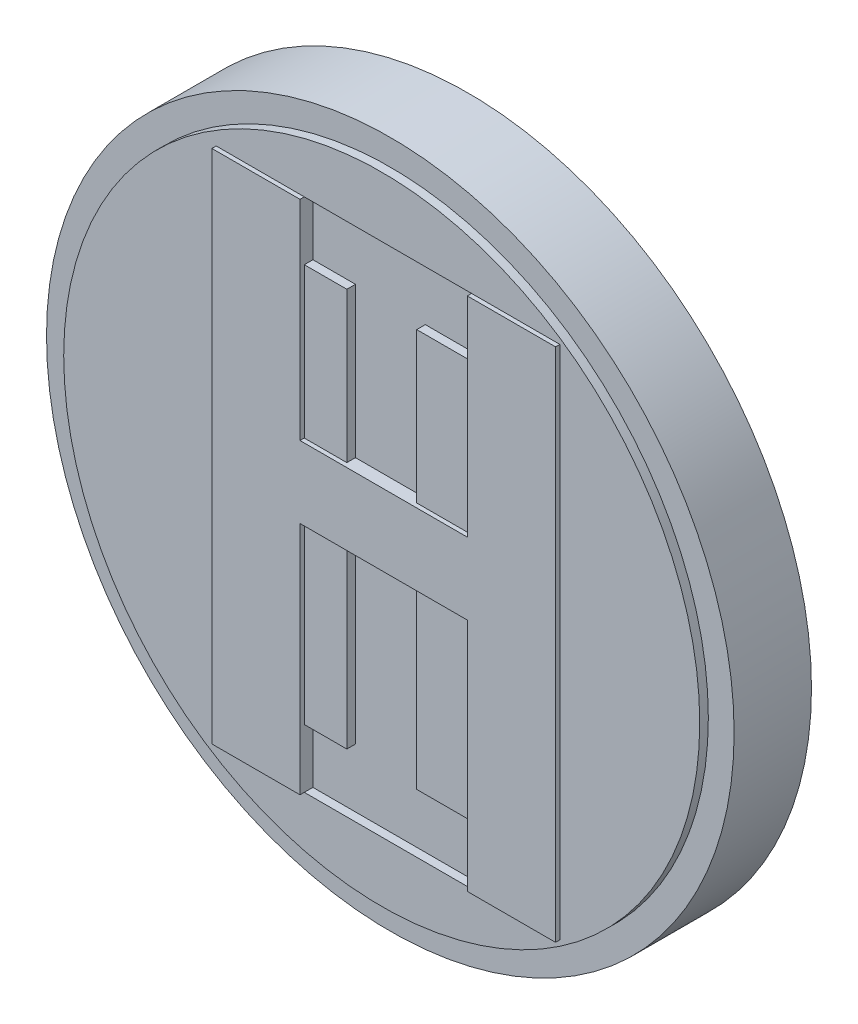
from build123d import *

# Parameters (mm, degrees)
SKETCH2_R                = 40
BOSS_EXTRUDE1_DEPTH      = 10
CUT_EXTRUDE1_START       = -1
CUT_EXTRUDE1_OUTLINE_R   = 40
CUT_EXTRUDE1_OUTLINE_R_2 = 37
CUT_EXTRUDE1_DEPTH       = 1
CUT_EXTRUDE1_2_DEPTH     = 0.5


# Read off the part's stored shape, not the designer's step: Cut-Extrude1
with BuildPart() as part:
    # Sketch2 → Boss-Extrude1 (new body)
    with BuildSketch(Plane.XY):
        Circle(SKETCH2_R)
    extrude(amount=-BOSS_EXTRUDE1_DEPTH)

    # Cut-Extrude1 outline → Cut-Extrude1 (cut)
    # profile 1 of 3: a face of its own
    with BuildSketch(Plane.XY.offset(CUT_EXTRUDE1_START)):
        Circle(CUT_EXTRUDE1_OUTLINE_R)
        Circle(CUT_EXTRUDE1_OUTLINE_R_2, mode=Mode.SUBTRACT)
    # profile 2 of 3: a face of its own
    with BuildSketch(Plane.XY.offset(CUT_EXTRUDE1_START)):
        Polygon((-9.007120253, -30), (10.454905063, -30), (10.454905063, -23.164556962), (4.070411392, -23.164556962), (4.070411392, -2.658227848), (-4.058544304, -2.658227848), (-4.058544304, -23.164556962), (-9.007120253, -23.164556962), align=None)
    # profile 3 of 3: a face of its own
    with BuildSketch(Plane.XY.offset(CUT_EXTRUDE1_START)):
        Polygon((-4.058544304, 5.696202532), (4.070411392, 5.696202532), (4.070411392, 23.164556962), (10.454905063, 23.164556962), (10.454905063, 30), (-9.007120253, 30), (-9.007120253, 23.164556962), (-4.058544304, 23.164556962), align=None)
    extrude(amount=CUT_EXTRUDE1_DEPTH, mode=Mode.SUBTRACT)

    # Cut-Extrude1 2 outline → Cut-Extrude1 2 (add)
    with BuildSketch(Plane.XY):
        Polygon((10.454905063, 30), (10.454905063, 5.696202532), (-9.007120253, 5.696202532), (-9.007120253, 30), (-19.26028481, 30), (-19.26028481, -30), (-9.007120253, -30), (-9.007120253, -2.658227848), (10.454905063, -2.658227848), (10.454905063, -30), (20.719936709, -30), (20.719936709, 30), align=None)
    extrude(amount=CUT_EXTRUDE1_2_DEPTH)


solid = part.part
